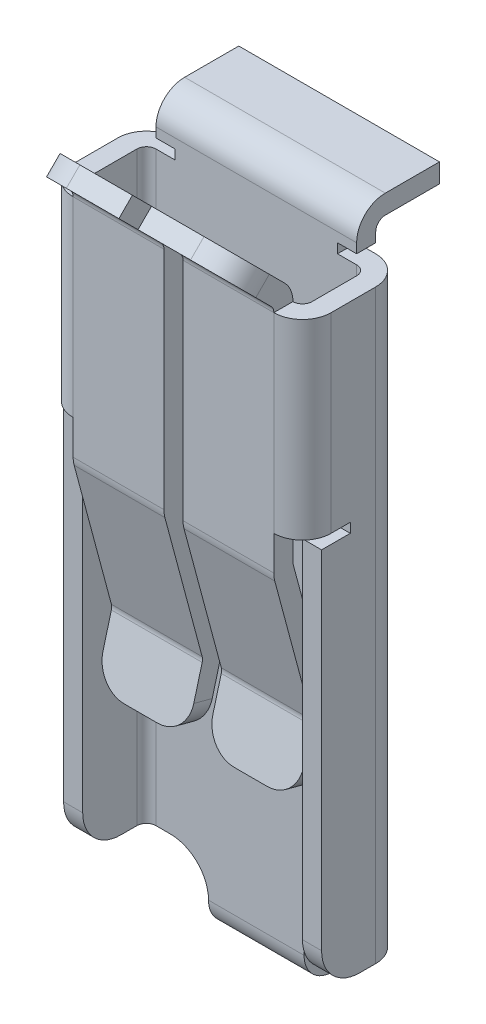
from build123d import *

# Parameters (mm, degrees)
CUT_EXTRUDE1_START     = -2.025
CUT_EXTRUDE1_OUTLINE_W = 3.186396103
CUT_EXTRUDE1_OUTLINE_H = 1.6
CUT_EXTRUDE1_DEPTH     = 4.05
CUT_EXTRUDE1_START_2   = -1.575
CUT_EXTRUDE1_2_DEPTH   = 1.425
CUT_EXTRUDE1_START_3   = 0.15
CUT_EXTRUDE1_3_DEPTH   = 1.425
SKETCH2_W              = 0.3
SKETCH2_H              = 3.186396103
CUT_EXTRUDE2_DEPTH     = 0.3
CUT_EXTRUDE3_DEPTH     = 0.186396103
SKETCH4_W              = 3.45
SKETCH4_H              = 3
CUT_EXTRUDE4_DEPTH     = 1
BOSS_EXTRUDE1_DEPTH    = 6.2
SKETCH6_W              = 2.55
SKETCH6_H              = 0.3
BOSS_EXTRUDE2_DEPTH    = 0.75
SKETCH7_W              = 0.3
SKETCH7_H              = 0.6
BOSS_EXTRUDE3_DEPTH    = 0.3
SKETCH8_W              = 0.3
SKETCH8_H              = 0.6
BOSS_EXTRUDE4_DEPTH    = 0.3
SKETCH9_W              = 3.15
SKETCH9_H              = 0.3
BOSS_EXTRUDE5_DEPTH    = 1
SKETCH10_W             = 0.3
SKETCH10_H             = 6.05
BOSS_EXTRUDE6_DEPTH    = 0.45
SKETCH11_W             = 1.5
SKETCH11_H             = 0.3
BOSS_EXTRUDE7_DEPTH    = 1.05
SKETCH12_W             = 1.5
SKETCH12_H             = 0.3
BOSS_EXTRUDE8_DEPTH    = 1
SKETCH13_W             = 0.3
SKETCH13_H             = 6.05
BOSS_EXTRUDE9_DEPTH    = 0.45
DRAFT1_ANGLE           = 45
DRAFT2_ANGLE           = 45
FILLET1_R              = 0.15
FILLET2_R              = 0.45
FILLET3_R              = 0.6


with BuildPart() as part:
    # Cut-Extrude1: read off the stored shape, not the designer's step
    # Cut-Extrude1 outline → Cut-Extrude1 (new body)
    with BuildSketch(Plane.YZ.offset(CUT_EXTRUDE1_START)):
        with Locations((3.343198051, 0.8)):
            Rectangle(CUT_EXTRUDE1_OUTLINE_W, CUT_EXTRUDE1_OUTLINE_H)
    extrude(amount=CUT_EXTRUDE1_DEPTH)

    # Cut-Extrude1 2 outline → Cut-Extrude1 2 (add)
    with BuildSketch(Plane.YZ.offset(CUT_EXTRUDE1_START_2)):
        Polygon((4.936396103, 1.6), (4.936396103, 1.3), (5.73137085, 2.094974747), (4.812132034, 3.014213562), (4.812132034, 1.6), align=None)
        Polygon((1.189495749, 1.3), (1.75, 1.3), (1.75, 1.6), (1.15, 1.6), (-1.128726234, 0.989417146), (-2.09465206, 1.248236191), (-2.172297774, 0.958458443), (-1.128726234, 0.678834292), align=None)
    extrude(amount=CUT_EXTRUDE1_2_DEPTH)

    # Cut-Extrude1 3 outline → Cut-Extrude1 3 (add)
    with BuildSketch(Plane.YZ.offset(CUT_EXTRUDE1_START_3)):
        Polygon((4.936396103, 1.6), (4.936396103, 1.3), (5.73137085, 2.094974747), (4.812132034, 3.014213562), (4.812132034, 1.6), align=None)
        Polygon((1.189495749, 1.3), (1.75, 1.3), (1.75, 1.6), (1.15, 1.6), (-1.128726234, 0.989417146), (-2.09465206, 1.248236191), (-2.172297774, 0.958458443), (-1.128726234, 0.678834292), align=None)
    extrude(amount=CUT_EXTRUDE1_3_DEPTH)

    # Sketch2 → Cut-Extrude2 (cut)
    with BuildSketch(Plane.XY.offset(1.6)):
        with Locations((0, 3.343198051)):
            Rectangle(SKETCH2_W, SKETCH2_H)
    extrude(amount=-CUT_EXTRUDE2_DEPTH, mode=Mode.SUBTRACT)

    # Sketch3 → Cut-Extrude3 (cut)
    with BuildSketch(Plane(origin=(0, 4.936396103, 0), x_dir=(-1, 0, 0), z_dir=(0, 1, 0))):
        Polygon((-1.575, 1.3), (-1.575, 1.6), (-2.025, 1.6), (-2.025, 0), (2.025, 0), (2.025, 1.6), (1.575, 1.6), (1.575, 1.3), (0.15, 1.3), (-0.15, 1.3), align=None)
    extrude(amount=-CUT_EXTRUDE3_DEPTH, mode=Mode.SUBTRACT)

    # Sketch4 → Cut-Extrude4 (cut)
    with BuildSketch(Plane.XY.offset(1.3)):
        with Locations((0, 3.25)):
            Rectangle(SKETCH4_W, SKETCH4_H)
    extrude(amount=-CUT_EXTRUDE4_DEPTH, mode=Mode.SUBTRACT)

    # Sketch5 → Boss-Extrude1 (add)
    with BuildSketch(Plane.XZ.offset(-1.75)):
        Polygon((-1.725, 0.85), (-1.725, 0.3), (1.725, 0.3), (1.725, 0.85), (2.025, 0.85), (2.025, 0), (-2.025, 0), (-2.025, 0.85), align=None)
    extrude(amount=BOSS_EXTRUDE1_DEPTH)

    # Sketch6 → Boss-Extrude2 (add)
    with BuildSketch(Plane(origin=(0, 4.75, 0), x_dir=(-1, 0, 0), z_dir=(0, 1, 0))):
        with Locations((0, 0.15)):
            Rectangle(SKETCH6_W, SKETCH6_H)
    extrude(amount=BOSS_EXTRUDE2_DEPTH)

    # Sketch7 → Boss-Extrude3 (add)
    with BuildSketch(Plane.ZY.offset(1.275)):
        with Locations((0.15, 5.2)):
            Rectangle(SKETCH7_W, SKETCH7_H)
    extrude(amount=BOSS_EXTRUDE3_DEPTH)

    # Sketch8 → Boss-Extrude4 (add)
    with BuildSketch(Plane(origin=(1.275, 0, 0), x_dir=(0, 0, -1), z_dir=(1, 0, 0))):
        with Locations((-0.15, 5.2)):
            Rectangle(SKETCH8_W, SKETCH8_H)
    extrude(amount=BOSS_EXTRUDE4_DEPTH)

    # Sketch9 → Boss-Extrude5 (add)
    with BuildSketch(Plane(origin=(0, 0, 0), x_dir=(-1, 0, 0), z_dir=(0, 0, -1))):
        with Locations((0, 5.35)):
            Rectangle(SKETCH9_W, SKETCH9_H)
    extrude(amount=BOSS_EXTRUDE5_DEPTH)

    # Sketch10 → Boss-Extrude6 (add)
    with BuildSketch(Plane.XY.offset(0.85)):
        with Locations((-1.875, -1.425)):
            Rectangle(SKETCH10_W, SKETCH10_H)
    extrude(amount=BOSS_EXTRUDE6_DEPTH)

    # Sketch11 → Boss-Extrude7 (add)
    with BuildSketch(Plane.XZ.offset(4.45)):
        with Locations((0, 0.15)):
            Rectangle(SKETCH11_W, SKETCH11_H)
    extrude(amount=BOSS_EXTRUDE7_DEPTH)

    # Sketch12 → Boss-Extrude8 (add)
    with BuildSketch(Plane(origin=(0, 0, 0), x_dir=(-1, 0, 0), z_dir=(0, 0, -1))):
        with Locations((0, -5.35)):
            Rectangle(SKETCH12_W, SKETCH12_H)
    extrude(amount=BOSS_EXTRUDE8_DEPTH)

    # Sketch13 → Boss-Extrude9 (add)
    with BuildSketch(Plane.XY.offset(0.85)):
        with Locations((1.875, -1.425)):
            Rectangle(SKETCH13_W, SKETCH13_H)
    extrude(amount=BOSS_EXTRUDE9_DEPTH)

    # Draft1
    draft1_faces = [part.faces().sort_by_distance(p)[0] for p in [
        (0.8625, 4.812132034, 2.307106781),
    ]]
    draft(draft1_faces, Plane(origin=(0.960282071, 3.25, 1.6), x_dir=(1, 0, 0), z_dir=(0, 0, 1)), DRAFT1_ANGLE)

    # Draft2
    draft2_faces = [part.faces().sort_by_distance(p)[0] for p in [
        (-0.8625, 4.812132034, 2.307106781),
    ]]
    draft(draft2_faces, Plane(origin=(0.960282071, 3.25, 1.6), x_dir=(1, 0, 0), z_dir=(0, 0, 1)), DRAFT2_ANGLE)

    # Fillet1
    fillet1_edges = [part.edges().sort_by_distance(p)[0] for p in [
        (1.725, 3.25, 1.3),
        (0.8625, 1.189495749, 1.3),
        (0, -5.2, 0),
        (-0.8625, 4.812132034, 1.6),
        (0, 5.2, 0),
        (-1.725, 0.15, 0.3),
        (-0.8625, -1.128726234, 0.989417146),
        (-1.725, 3.25, 1.3),
        (0.8625, 4.812132034, 1.6),
        (0.8625, -1.128726234, 0.989417146),
        (-0.8625, 1.189495749, 1.3),
        (1.725, 0.15, 0.3),
    ]]
    fillet(fillet1_edges, radius=FILLET1_R)

    # Fillet2
    fillet2_edges = [part.edges().sort_by_distance(p)[0] for p in [
        (-2.025, 3.25, 1.6),
        (1.575, -2.133474917, 1.103347317),
        (0.15, -2.133474917, 1.103347317),
        (0.8625, -1.128726234, 0.678834292),
        (-0.8625, 4.936396103, 1.3),
        (0, 5.5, 0.3),
        (-0.8625, 1.15, 1.6),
        (2.025, 3.25, 1.6),
        (-0.15, -2.133474917, 1.103347317),
        (-1.575, -2.133474917, 1.103347317),
        (2.025, 0.15, 0),
        (-2.025, 0.15, 0),
        (0, -5.5, 0.3),
        (-0.8625, -1.128726234, 0.678834292),
        (0.8625, 4.936396103, 1.3),
        (0.8625, 1.15, 1.6),
    ]]
    fillet(fillet2_edges, radius=FILLET2_R)

    # Fillet3
    fillet3_edges = [part.edges().sort_by_distance(p)[0] for p in [
        (1.575, 5.625304833, 2.201040764),
        (1.875, -4.45, 1.3),
        (-1.875, -4.45, 1.3),
        (-0.75, -4.45, 0.15),
        (-1.575, 5.625304833, 2.201040764),
        (0.75, -4.45, 0.15),
    ]]
    fillet(fillet3_edges, radius=FILLET3_R)


solid = part.part
